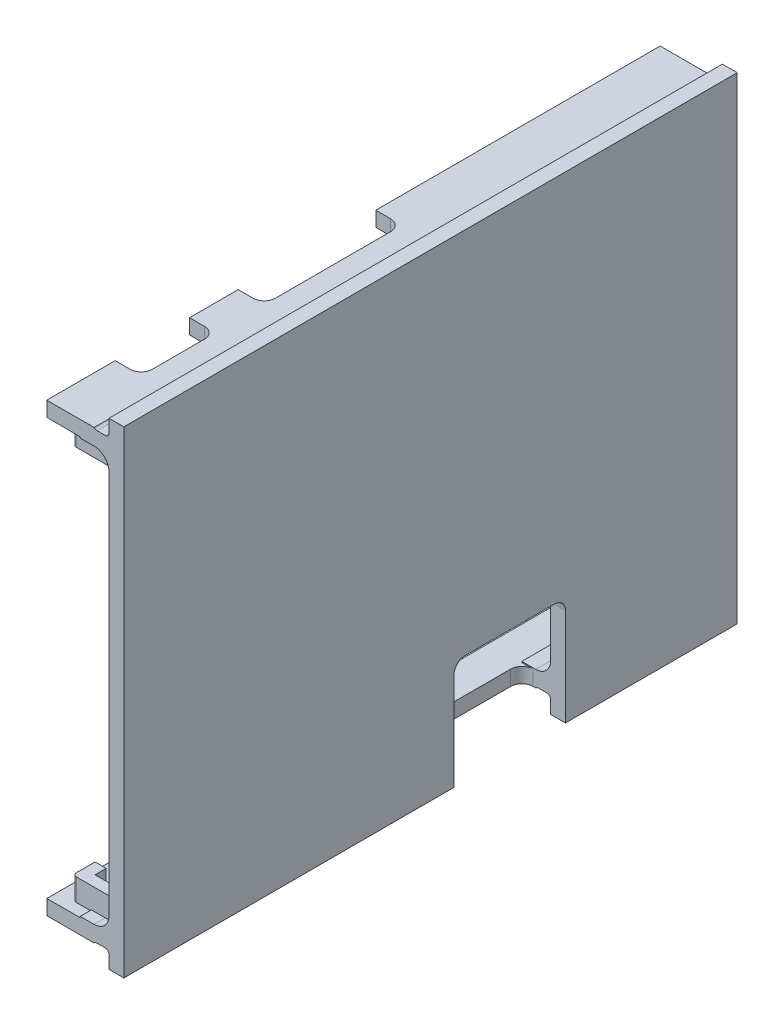
from build123d import *

# Parameters (mm, degrees)
BOSS_EXTRUDE1_START  = -82.5
BOSS_EXTRUDE1_DEPTH  = 82.5
SKETCH2_W            = 8.569638255
SKETCH2_H            = 10
SKETCH2_H_2          = 18.5
CUT_EXTRUDE1_DEPTH   = 93.549500309
FILLET2_R            = 2
FILLET3_R            = 0.5
CUT_EXTRUDE2_START   = -17.5
SKETCH2_3_W          = 11.636747081
SKETCH2_3_H          = 15
CUT_EXTRUDE2_DEPTH   = 76.049500309
FILLET1_R            = 1.5
BOSS_EXTRUDE3_START  = -3.5
BOSS_EXTRUDE3_DEPTH  = 3
BOSS_EXTRUDE4_START  = -5
BOSS_EXTRUDE4_DEPTH  = 1.5
FILLET5_R            = 0.5
FILLET5_OF_MIRROR4_R = 0.5


# Read off the part's stored shape, not the designer's step: Boss-Extrude1
with BuildPart() as part:
    # Boss-Extrude1 outline → Boss-Extrude1 (new body)
    with BuildSketch(Plane.XY.offset(-2).offset(BOSS_EXTRUDE1_START)):
        Polygon((17.868316672, 32.1), (17.868316672, 29.85), (15.868316672, 29.85), (15.868316672, 30.024283949), (9.5, 30.024283949), (9.5, 28.024283949), (14, 28), (14, 27.85), (17.868316672, 27.85), (17.868316672, 0), (19.868316672, 0), (19.868316672, 32.1), align=None)
    boss_extrude1 = extrude(amount=BOSS_EXTRUDE1_DEPTH)

    # Mirror1: Boss-Extrude1 across plane
    add(boss_extrude1.mirror(Plane.ZX))

    # Sketch2 → Cut-Extrude1 (cut, through all)
    with BuildSketch(Plane(origin=(0, 0, 0), x_dir=(1, 0, 0), z_dir=(0, 1, 0))):
        with Locations((8.715180872, 16.2)):
            Rectangle(SKETCH2_W, SKETCH2_H)
        with Locations((8.715180872, 37)):
            Rectangle(SKETCH2_W, SKETCH2_H_2)
    extrude(amount=CUT_EXTRUDE1_DEPTH, mode=Mode.SUBTRACT)

    # Fillet2
    fillet2_edges = [part.edges().sort_by_distance(p)[0] for p in [
        (17.868316672, 27.85, -43.25),
        (17.868316672, -27.85, -43.25),
    ]]
    fillet(fillet2_edges, radius=FILLET2_R)

    # Fillet3
    # the kernel refuses this fillet: 0.5 mm, written as the material it adds along each edge
    with BuildSketch(Plane(origin=(15.868316672, -29.85, -84.5), x_dir=(0, -1, 0), z_dir=(0, 0, 1))) as fillet3_piece_1:
        with BuildLine():
            CenterArc((0.5, 0.379353469), FILLET3_R, 180, 49.350336553)
            Line((0, 0.379353469), (-0.01, 0.379353469))
            Line((-0.01, 0.379353469), (-0.01, 0))
            Line((-0.01, 0), (0, -0.01))
            ThreePointArc((0, -0.01), (0.087141974, -0.01), (0.167769628, -0.007587069))
            Line((0.167769628, -0.007587069), (0.174283949, 0))
        make_face()
    extrude(amount=82.5)
    with BuildSketch(Plane(origin=(17.868316672, -29.85, -84.5), x_dir=(-1, 0, 0), z_dir=(0, 0, 1))) as fillet3_piece_2:
        with BuildLine():
            CenterArc((FILLET3_R, FILLET3_R), FILLET3_R, 180, 90)
            Line((0, FILLET3_R), (-FILLET3_R * 0.02, FILLET3_R))
            Line((-FILLET3_R * 0.02, FILLET3_R), (-FILLET3_R * 0.02, -FILLET3_R * 0.02))
            Line((-FILLET3_R * 0.02, -FILLET3_R * 0.02), (FILLET3_R, -FILLET3_R * 0.02))
            Line((FILLET3_R, -FILLET3_R * 0.02), (FILLET3_R, 0))
        make_face()
    extrude(amount=82.5)
    with BuildSketch(Plane(origin=(17.868316672, 29.85, -84.5), x_dir=(-1, 0, 0), z_dir=(0, 0, 1))) as fillet3_piece_3:
        with BuildLine():
            CenterArc((FILLET3_R, -FILLET3_R), FILLET3_R, 90, 90)
            Line((0, -FILLET3_R), (-FILLET3_R * 0.02, -FILLET3_R))
            Line((-FILLET3_R * 0.02, -FILLET3_R), (-FILLET3_R * 0.02, FILLET3_R * 0.02))
            Line((-FILLET3_R * 0.02, FILLET3_R * 0.02), (FILLET3_R, FILLET3_R * 0.02))
            Line((FILLET3_R, FILLET3_R * 0.02), (FILLET3_R, 0))
        make_face()
    extrude(amount=82.5)
    with BuildSketch(Plane(origin=(15.868316672, 29.85, -84.5), x_dir=(0, 1, 0), z_dir=(0, 0, 1))) as fillet3_piece_4:
        with BuildLine():
            CenterArc((0.5, -0.379353469), FILLET3_R, 130.649663447, 49.350336553)
            Line((0, -0.379353469), (-0.01, -0.379353469))
            Line((-0.01, -0.379353469), (-0.01, 0))
            Line((-0.01, 0), (0, 0.01))
            ThreePointArc((0, 0.01), (0.087141974, 0.01), (0.167769628, 0.007587069))
            Line((0.167769628, 0.007587069), (0.174283949, 0))
        make_face()
    extrude(amount=82.5)

    # Sketch2<3> → Cut-Extrude2 (cut, through all)
    with BuildSketch(Plane(origin=(0, 0, 0), x_dir=(1, 0, 0), z_dir=(0, 1, 0)).offset(CUT_EXTRUDE2_START)):
        with Locations((19.818373541, 53.901910681)):
            Rectangle(SKETCH2_3_W, SKETCH2_3_H)
    extrude(amount=-CUT_EXTRUDE2_DEPTH, mode=Mode.SUBTRACT)

    # Fillet1
    fillet1_edges = [part.edges().sort_by_distance(p)[0] for p in [
        (18.868316672, -17.5, -46.401910681),
        (14, -29.012141975, -46.401910681),
        (14, -29.012141975, -61.401910681),
        (18.868316672, -17.5, -61.401910681),
        (13, 29.014840191, -11.2),
        (13, 29.014840191, -21.2),
        (13, 29.014840191, -27.75),
        (13, 29.014840191, -46.25),
    ]]
    fillet(fillet1_edges, radius=FILLET1_R)

    # Sketch3 → Boss-Extrude3 (add)
    with BuildSketch(Plane.XY.offset(BOSS_EXTRUDE3_START)):
        Polygon((11.5, 28.013491083), (13, 28.005396433), (13, 25.013491083), (11.5, 25.013491083), align=None)
    boss_extrude3 = extrude(amount=-BOSS_EXTRUDE3_DEPTH)

    # Sketch3<6> → Boss-Extrude4 (add)
    with BuildSketch(Plane.XY.offset(BOSS_EXTRUDE4_START)):
        Polygon((13, 28.005396433), (17.868316672, 27.979124888), (17.868316672, 25.013491083), (13, 25.013491083), align=None)
    boss_extrude4 = extrude(amount=BOSS_EXTRUDE4_DEPTH)

    # Fillet5
    fillet5_edges = [part.edges().sort_by_distance(p)[0] for p in [
        (11.5, 26.513491083, -3.5),
    ]]
    fillet(fillet5_edges, radius=FILLET5_R)

    # Mirror4: Boss-Extrude3, Boss-Extrude4 across plane
    add(boss_extrude3.mirror(Plane.ZX))
    add(boss_extrude4.mirror(Plane.ZX))

    # Fillet5 of Mirror4
    fillet5_of_mirror4_edges = [part.edges().sort_by_distance(p)[0] for p in [
        (11.5, -26.513491083, -3.5),
    ]]
    fillet(fillet5_of_mirror4_edges, radius=FILLET5_OF_MIRROR4_R)


solid = part.part
